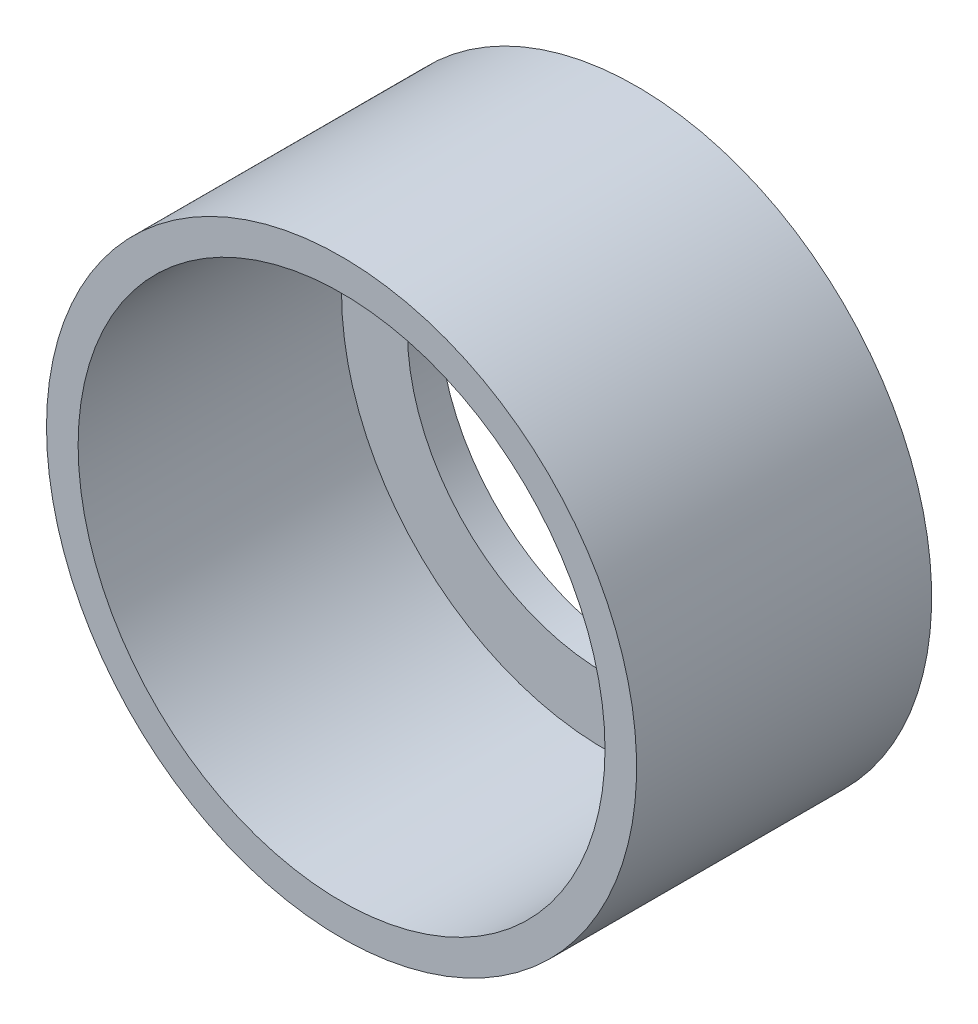
from build123d import *


with BuildPart() as part:
    # Sketch1 → Revolve1 (revolve)
    with BuildSketch(Plane(origin=(0, 0, 0), x_dir=(1, 0, 0), z_dir=(0, 1, 0))):
        Polygon((12.7, 5.425637802), (14.224, 5.425637802), (14.224, 19.649637802), (9.525, 19.649637802), (9.525, 18.125637802), (12.7, 18.125637802), align=None)
    revolve(axis=Axis((0, 0, -10.179008168), (0, 0, 1)))


solid = part.part
